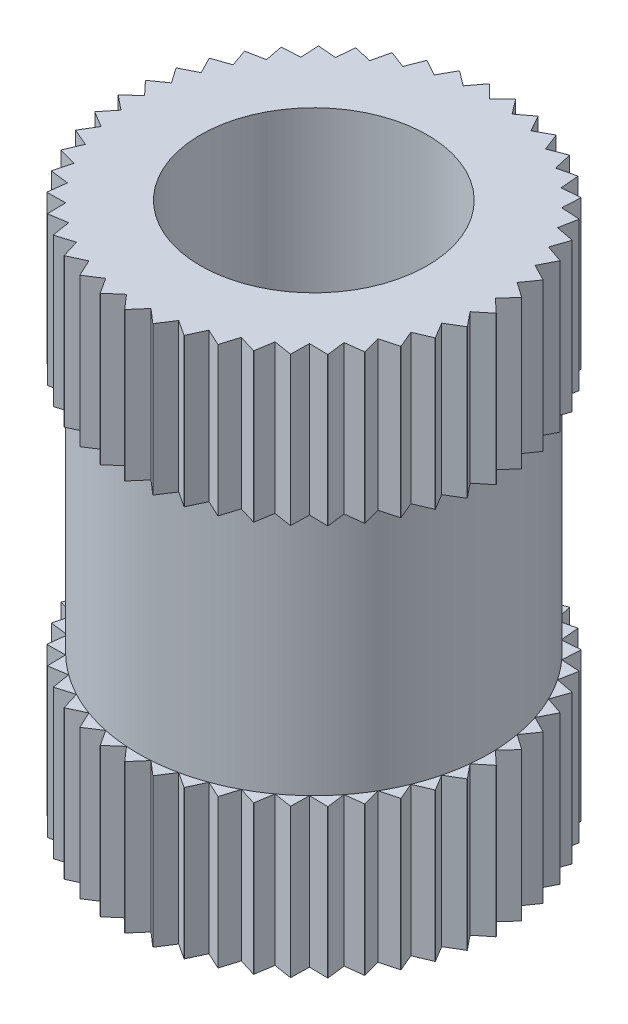
from build123d import *

# Parameters (mm, degrees)
CUT_EXTRUDE1_DEPTH    = 12.157956802
CIRPATTERN1_COUNT     = 45
M5X0_8_TAPPED_HOLE1_D = 4.2


with BuildPart() as part:
    # Sketch1 → Revolve1 (revolve)
    with BuildSketch(Plane.XY):
        Polygon((0, 0), (0, 10), (-3.5, 10), (-3.5, 7.25), (-3.25, 7.25), (-3.25, 2.75), (-3.5, 2.75), (-3.5, 0), align=None)
    revolve(axis=Axis((0, 0, 0), (0, 1, 0)))

    # Sketch2 → Cut-Extrude1 (cut, through all)
    with BuildSketch(Plane(origin=(0, 10, 0), x_dir=(1, 0, 0), z_dir=(0, 1, 0))):
        with BuildLine():
            Line((-0.241648065, 3.491648065), (0, 3.25))
            Line((0, 3.25), (0.241648065, 3.491648065))
            ThreePointArc((0.241648065, 3.491648065), (0, 3.5), (-0.241648065, 3.491648065))
        make_face()
    cut_extrude1 = extrude(amount=-CUT_EXTRUDE1_DEPTH, mode=Mode.SUBTRACT)

    # CirPattern1: Cut-Extrude1 ×45 about axis
    cirpattern1_axis = Axis((0, 6.3, 0), (0, -1, 0))
    for i in range(1, CIRPATTERN1_COUNT):
        add(cut_extrude1.rotate(cirpattern1_axis, i * 360 / CIRPATTERN1_COUNT), mode=Mode.SUBTRACT)

    # M5x0.8 Tapped Hole1 (through all)
    with Locations(Plane(origin=(0, 10, 0), x_dir=(1, 0, 0), z_dir=(0, 1, 0))):
        with Locations((0, 0)):
            Hole(M5X0_8_TAPPED_HOLE1_D / 2)


solid = part.part
